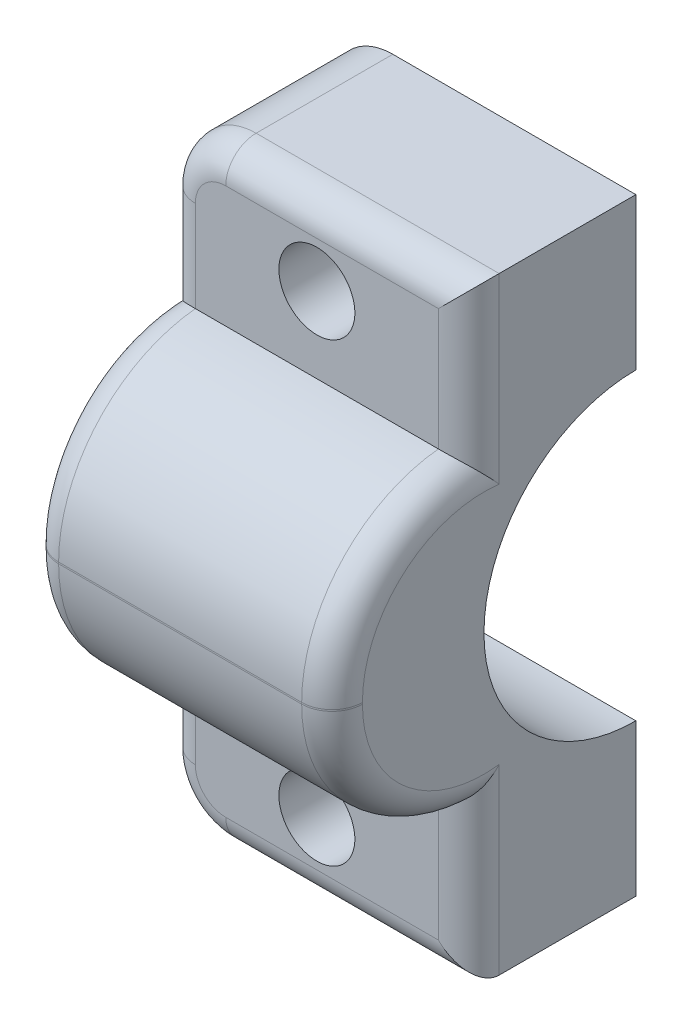
from build123d import *

# Parameters (mm, degrees)
SKETCH3_R                 = 2.75
BOSS_EXTRUDE1_DEPTH       = 6
BOSS_EXTRUDE1_2_DEPTH     = 6
BOSS_EXTRUDE1_3_DEPTH     = 6
BOSS_EXTRUDE1_4_DEPTH     = 6
SKETCH4_W                 = 43
SKETCH4_H                 = 86
BOSS_EXTRUDE2_DEPTH       = 2.5
SKETCH5_R                 = 2.75
BOSS_EXTRUDE3_DEPTH       = 10
LPATTERN1_COUNT           = 2
LPATTERN1_PITCH           = 37
LPATTERN2_COUNT           = 2
LPATTERN2_PITCH           = 37
LPATTERN2_COPY_1_SKETCH_R = 2.75
LPATTERN2_COPY_1_DEPTH    = 10
SKETCH6_W                 = 87
SKETCH6_H                 = 86
BOSS_EXTRUDE4_DEPTH       = 2.5
BOSS_EXTRUDE5_DEPTH       = 2
SKETCH12_W                = 4
SKETCH12_H                = 8
CUT_EXTRUDE1_DEPTH        = 4
SKETCH14_R                = 0.85
CUT_EXTRUDE2_DEPTH        = 4.5
LPATTERN3_COUNT           = 2
LPATTERN3_PITCH           = 46.5
BOSS_EXTRUDE6_DEPTH       = 35
SKETCH18_W                = 2
SKETCH18_H                = 35
BOSS_EXTRUDE7_DEPTH       = 18.5
SKETCH19_W                = 32.48
SKETCH19_H                = 17.04
BOSS_EXTRUDE8_DEPTH       = 10
SKETCH20_W                = 8.16
SKETCH20_H                = 13.04
CUT_EXTRUDE3_DEPTH        = 10
SKETCH21_W                = 1.1
SKETCH21_H                = 86
CUT_EXTRUDE4_DEPTH        = 10
FILLET2_R                 = 2
FILLET4_R                 = 20
BOSS_EXTRUDE9_DEPTH       = 2.5
SKETCH24_W                = 10
SKETCH24_H                = 20
BOSS_EXTRUDE10_DEPTH      = 30
SKETCH25_R                = 5
CUT_EXTRUDE6_DEPTH        = 30
FILLET6_R                 = 10
FILLET8_R                 = 2
SKETCH27_W                = 20
SKETCH27_H                = 20.130693805
CUT_EXTRUDE7_DEPTH        = 22.5
CUT_EXTRUDE10_DEPTH       = 7.5
CUT_EXTRUDE10_DEPTH_BACK  = 210.5
SKETCH28_W                = 79.126815109
SKETCH28_H                = 112.332596714
SKETCH29_R                = 1.25
CUT_EXTRUDE11_DEPTH       = 19.5
SKETCH30_W                = 10
SKETCH30_H                = 5
CUT_EXTRUDE12_DEPTH       = 4.5
FILLET9_R                 = 5
FILLET9_OF_MIRROR5_R      = 5
FILLET11_R                = 1


with BuildPart() as part:
    # Sketch3 → Boss-Extrude1 (new body)
    with BuildSketch(Plane.XY):
        with Locations((-25, -3)):
            Circle(SKETCH3_R)
    boss_extrude1 = extrude(amount=BOSS_EXTRUDE1_DEPTH)



with BuildPart() as body_2:
    # Sketch3 → Boss-Extrude1 2 (new body)
    with BuildSketch(Plane.XY):
        with Locations((-62, -3)):
            Circle(SKETCH3_R)
    boss_extrude1_2 = extrude(amount=BOSS_EXTRUDE1_2_DEPTH)


with BuildPart() as body_3:
    # Sketch3 → Boss-Extrude1 3 (new body)
    with BuildSketch(Plane.XY):
        with Locations(Location((-25, -40, 0), (0, 0, 180))):
            Circle(SKETCH3_R)
    boss_extrude1_3 = extrude(amount=BOSS_EXTRUDE1_3_DEPTH)


with BuildPart() as body_4:
    # Sketch3 → Boss-Extrude1 4 (new body)
    with BuildSketch(Plane.XY):
        with Locations(Location((-62, -40, 0), (0, 0, 180))):
            Circle(SKETCH3_R)
    boss_extrude1_4 = extrude(amount=BOSS_EXTRUDE1_4_DEPTH)


with BuildPart() as part_1:
    add(part.part)

    add(body_2.part)  # Boss-Extrude2 merges body 2

    add(body_3.part)  # Boss-Extrude2 merges body 3

    add(body_4.part)  # Boss-Extrude2 merges body 4
    # Sketch4 → Boss-Extrude2 (add)
    with BuildSketch(Plane.XY):
        with Locations((-43.5, 0)):
            Rectangle(SKETCH4_W, SKETCH4_H)
    extrude(amount=-BOSS_EXTRUDE2_DEPTH)

    # Mirror4: Boss-Extrude1, Boss-Extrude1 2, Boss-Extrude1 3, Boss-Extrude1 4 across plane
    add(boss_extrude1.mirror(Plane.ZX))
    add(boss_extrude1_2.mirror(Plane.ZX))
    add(boss_extrude1_3.mirror(Plane.ZX))
    add(boss_extrude1_4.mirror(Plane.ZX))

    # Sketch5 → Boss-Extrude3 (add)
    with BuildSketch(Plane.XY.offset(6)):
        with Locations((-25, 40)):
            Circle(SKETCH5_R)
    boss_extrude3 = extrude(amount=BOSS_EXTRUDE3_DEPTH)

    # LPattern1: Boss-Extrude3 ×2
    with Locations(*[(-i * LPATTERN1_PITCH, 0, 0) for i in range(1, LPATTERN1_COUNT)]):
        add(boss_extrude3)

    # LPattern2: Boss-Extrude3 ×2
    with Locations(*[(0, -i * LPATTERN2_PITCH, 0) for i in range(1, LPATTERN2_COUNT)]):
        add(boss_extrude3)

    # LPattern2 copy 1 sketch → LPattern2 copy 1 (add)
    with BuildSketch(Plane(origin=(-37, -37, 6), x_dir=(1, 0, 0), z_dir=(0, 0, 1))):
        with Locations((-25, 40)):
            Circle(LPATTERN2_COPY_1_SKETCH_R)
    extrude(amount=LPATTERN2_COPY_1_DEPTH)

    # Sketch6 → Boss-Extrude4 (add)
    with BuildSketch(Plane.XY):
        with Locations((21.5, 0)):
            Rectangle(SKETCH6_W, SKETCH6_H)
    extrude(amount=-BOSS_EXTRUDE4_DEPTH)

    # Sketch11 → Boss-Extrude5 (add, symmetric)
    with BuildSketch(Plane(origin=(-6, 0, 0), x_dir=(0, 0, -1), z_dir=(1, 0, 0))):
        Polygon((0, -43), (-40, -43), (-40, -39), (0, -18), align=None)
    boss_extrude5 = extrude(amount=BOSS_EXTRUDE5_DEPTH, both=True)

    # Sketch12 → Cut-Extrude1 (cut)
    with BuildSketch(Plane.ZY.offset(8)):
        with Locations((8, -32)):
            Rectangle(SKETCH12_W, SKETCH12_H)
    extrude(amount=-CUT_EXTRUDE1_DEPTH, mode=Mode.SUBTRACT)

    # Sketch14 → Cut-Extrude2 (cut)
    with BuildSketch(Plane.XZ.offset(43)):
        with Locations(Location((-6, 37, 0), (0, 0, 270))):
            Circle(SKETCH14_R)
        with Locations(Location((-6, 13.6, 0), (0, 0, 270))):
            Circle(SKETCH14_R)
    cut_extrude2 = extrude(amount=-CUT_EXTRUDE2_DEPTH, mode=Mode.SUBTRACT)

    # LPattern3: Boss-Extrude5, Cut-Extrude2 ×2
    with Locations(*[(i * LPATTERN3_PITCH, 0, 0) for i in range(1, LPATTERN3_COUNT)]):
        add(boss_extrude5)
        add(cut_extrude2, mode=Mode.SUBTRACT)

    # Sketch17 → Boss-Extrude6 (add)
    with BuildSketch(Plane.XY):
        Polygon((42.5, -41), (42.5, -43), (63.9, -43), (63.9, 25.4), (40.5, 25.4), (40.5, -18), (42.5, -18), (42.5, 23.4), (61.9, 23.4), (61.9, -41), align=None)
    extrude(amount=BOSS_EXTRUDE6_DEPTH)

    # Sketch18 → Boss-Extrude7 (add)
    with BuildSketch(Plane.XZ.offset(18)):
        with Locations((41.5, 17.5)):
            Rectangle(SKETCH18_W, SKETCH18_H)
    extrude(amount=BOSS_EXTRUDE7_DEPTH)

    # Sketch19 → Boss-Extrude8 (add)
    with BuildSketch(Plane.XY):
        with Locations((16.24, 8.52)):
            Rectangle(SKETCH19_W, SKETCH19_H)
    extrude(amount=BOSS_EXTRUDE8_DEPTH)

    # Sketch20 → Cut-Extrude3 (cut)
    with BuildSketch(Plane.XY.offset(10)):
        with Locations((6.08, 8.52)):
            Rectangle(SKETCH20_W, SKETCH20_H)
        with Locations((16.24, 8.52)):
            Rectangle(SKETCH20_W, SKETCH20_H)
        with Locations((26.4, 8.52)):
            Rectangle(SKETCH20_W, SKETCH20_H)
    extrude(amount=-CUT_EXTRUDE3_DEPTH, mode=Mode.SUBTRACT)

    # Sketch21 → Cut-Extrude4 (cut)
    with BuildSketch(Plane.XY):
        with Locations((64.45, 0)):
            Rectangle(SKETCH21_W, SKETCH21_H)
    extrude(amount=-CUT_EXTRUDE4_DEPTH, mode=Mode.SUBTRACT)

    # Fillet2
    fillet2_edges = [part_1.edges().sort_by_distance(p)[0] for p in [
        (63.9, -43, 16.25),
        (63.9, 25.4, 17.5),
        (-65, -43, -1.25),
        (-65, 43, -1.25),
    ]]
    fillet(fillet2_edges, radius=FILLET2_R)

    # Fillet4
    fillet4_edges = [part_1.edges().sort_by_distance(p)[0] for p in [
        (63.9, 43, -1.25),
    ]]
    fillet(fillet4_edges, radius=FILLET4_R)

    # Sketch23 → Boss-Extrude9 (add)
    with BuildSketch(Plane(origin=(0, 0, -2.5), x_dir=(-1, 0, 0), z_dir=(0, 0, -1))):
        with BuildLine():
            Line((95.480174176, -10), (105, -10))
            Line((105, -10), (110, -10))
            Line((110, -10), (110, 10))
            Line((110, 10), (105, 10))
            Line((105, 10), (95.480174176, 10))
            add(Edge.make_bspline(
                [(95.480174176, 10), (68.262963787, 8.86232235), (65, 41)],
                knots=[0, 0, 0, 1, 1, 1], degree=2))
            Line((65, 41), (65, -41))
            add(Edge.make_bspline(
                [(95.480174176, -10), (68.262963787, -8.86232235), (65, -41)],
                knots=[0, 0, 0, 1, 1, 1], degree=2))
        make_face()
    extrude(amount=-BOSS_EXTRUDE9_DEPTH)

    # Sketch24 → Boss-Extrude10 (add)
    with BuildSketch(Plane.XY):
        with Locations((-105, 0)):
            Rectangle(SKETCH24_W, SKETCH24_H)
    extrude(amount=BOSS_EXTRUDE10_DEPTH)

    # Sketch25 → Cut-Extrude6 (cut)
    with BuildSketch(Plane.ZY.offset(110)):
        with Locations((20, 0)):
            Circle(SKETCH25_R)
    extrude(amount=-CUT_EXTRUDE6_DEPTH, mode=Mode.SUBTRACT)

    # Fillet6
    fillet6_edges = [part_1.edges().sort_by_distance(p)[0] for p in [
        (-100, 0, 0),
    ]]
    fillet(fillet6_edges, radius=FILLET6_R)

    # Fillet8
    fillet8_edges = [part_1.edges().sort_by_distance(p)[0] for p in [
        (-110, 10, 15),
        (-110, -10, 15),
    ]]
    fillet(fillet8_edges, radius=FILLET8_R)

    # Sketch27 → Cut-Extrude7 (cut)
    with BuildSketch(Plane(origin=(0, 0, -2.5), x_dir=(-1, 0, 0), z_dir=(0, 0, -1))):
        with Locations((100, -0.065346902)):
            Rectangle(SKETCH27_W, SKETCH27_H)
    extrude(amount=-CUT_EXTRUDE7_DEPTH, mode=Mode.SUBTRACT)


with BuildPart() as cut_extrude7_piece_1:
    # of the separate pieces the step leaves, piece 1, a body of its own (cut_extrude7_pieces)
    add(part_1.part.solids().sort_by_distance((-90, -10.130693805, -2.5))[0])

    # Sketch28 → Cut-Extrude10 (cut, two sides: drawn at the far end of the back side and taken through both)
    with BuildSketch(Plane.ZY.offset(90).offset(-CUT_EXTRUDE10_DEPTH_BACK)):
        with Locations((27.34304702, -0.64713832)):
            Rectangle(SKETCH28_W, SKETCH28_H)
    extrude(amount=CUT_EXTRUDE10_DEPTH + CUT_EXTRUDE10_DEPTH_BACK, mode=Mode.SUBTRACT)


with BuildPart() as cut_extrude7_piece_2:
    # of the separate pieces the step leaves, piece 2, a body of its own (cut_extrude7_pieces)
    add(part_1.part.solids().sort_by_distance((-108, 10, 20))[0])

    # Sketch29 → Cut-Extrude11 (cut)
    with BuildSketch(Plane(origin=(0, 0, 20), x_dir=(-1, 0, 0), z_dir=(0, 0, -1))):
        with Locations((105, 7.5)):
            Circle(SKETCH29_R)
    cut_extrude11 = extrude(amount=-CUT_EXTRUDE11_DEPTH, mode=Mode.SUBTRACT)

    # Sketch30 → Cut-Extrude12 (cut)
    with BuildSketch(Plane.XY.offset(30)):
        with Locations((-105, 7.5)):
            Rectangle(SKETCH30_W, SKETCH30_H)
    cut_extrude12 = extrude(amount=-CUT_EXTRUDE12_DEPTH, mode=Mode.SUBTRACT)

    # Fillet9
    # the kernel refuses this fillet: 5 mm, written as the material it takes off along each edge
    with BuildSketch(Plane(origin=(-122.437342964, 5, 30), x_dir=(0, -1, 0), z_dir=(1, 0, 0))) as fillet9_piece_1:
        with BuildLine():
            CenterArc((4.974937186, 5), FILLET9_R, 185.739170477, 84.260829523)
            Line((0, 4.5), (-0.099498744, 4.49))
            ThreePointArc((-0.099498744, 4.49), (-0.1, 2.25), (-0.1, 0))
            Line((-0.1, 0), (0, -0.1))
            Line((0, -0.1), (4.974937186, -0.1))
            Line((4.974937186, -0.1), (4.974937186, 0))
        make_face()
    extrude(amount=34.874685928, mode=Mode.SUBTRACT)

    # Mirror5: Cut-Extrude11, Cut-Extrude12 across plane
    add(cut_extrude11.mirror(Plane.ZX), mode=Mode.SUBTRACT)
    add(cut_extrude12.mirror(Plane.ZX), mode=Mode.SUBTRACT)

    # Fillet9 of Mirror5
    # the kernel refuses this fillet: 5 mm, written as the material it takes off along each edge
    with BuildSketch(Plane(origin=(-122.437342964, -5, 30), x_dir=(0, 0, -1), z_dir=(1, 0, 0))) as fillet9_of_mirror5_piece_1:
        with BuildLine():
            CenterArc((5, 4.974937186), FILLET9_OF_MIRROR5_R, 180, 84.260829523)
            Line((0, 4.974937186), (-0.1, 4.974937186))
            Line((-0.1, 4.974937186), (-0.1, 0))
            Line((-0.1, 0), (0, -0.1))
            ThreePointArc((0, -0.1), (2.25, -0.1), (4.49, -0.099498744))
            Line((4.49, -0.099498744), (4.5, 0))
        make_face()
    extrude(amount=34.874685928, mode=Mode.SUBTRACT)

    # Fillet11
    fillet11_edges = [cut_extrude7_piece_2.edges().sort_by_distance(p)[0] for p in [
        (-104, 10, 25.5),
        (-109.414213562, 9.414213562, 25.5),
        (-110, 6.5, 25.5),
        (-100, 7.5, 25.5),
        (-100, 3.379164781, 28.708099244),
        (-110, 0, 30),
        (-110, 3.379164781, 28.708099244),
        (-109.414213562, -9.414213562, 25.5),
        (-110, -6.5, 25.5),
        (-100, -7.5, 25.5),
        (-104, -10, 25.5),
        (-100, 0, 30),
        (-100, -3.379164781, 28.708099244),
        (-110, -3.379164781, 28.708099244),
    ]]
    fillet(fillet11_edges, radius=FILLET11_R)


solid = cut_extrude7_piece_2.part
